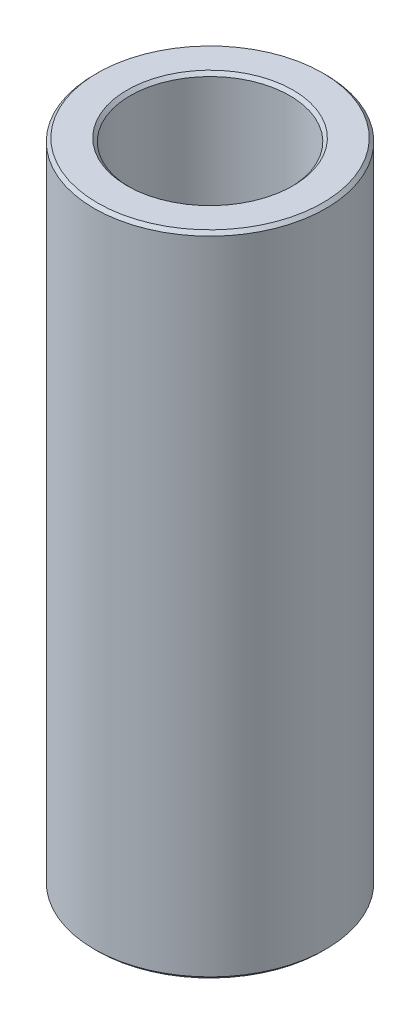
from build123d import *

# Parameters (mm, degrees)
SKETCH1_R           = 45
BOSS_EXTRUDE1_DEPTH = 251.729088075
SKETCH2_R           = 30.98509331
CUT_EXTRUDE1_DEPTH  = 260.648866323
CHAMFER1_SIZE       = 1.255145843


with BuildPart() as part:
    # Sketch1 → Boss-Extrude1 (new body)
    with BuildSketch(Plane(origin=(0, 0, 0), x_dir=(1, 0, 0), z_dir=(0, 1, 0))):
        Circle(SKETCH1_R)
    extrude(amount=BOSS_EXTRUDE1_DEPTH)

    # Sketch2 → Cut-Extrude1 (cut, through all)
    with BuildSketch(Plane(origin=(0, 0, 0), x_dir=(1, 0, 0), z_dir=(0, 1, 0))):
        Circle(SKETCH2_R)
    extrude(amount=CUT_EXTRUDE1_DEPTH, mode=Mode.SUBTRACT)

    # Chamfer1
    chamfer1_edges = [part.edges().sort_by_distance(p)[0] for p in [
        (-30.98509331, 251.729088075, 0),
        (-30.98509331, 0, 0),
        (-45, 0, 0),
        (-45, 251.729088075, 0),
    ]]
    chamfer(chamfer1_edges, length=CHAMFER1_SIZE)


solid = part.part
